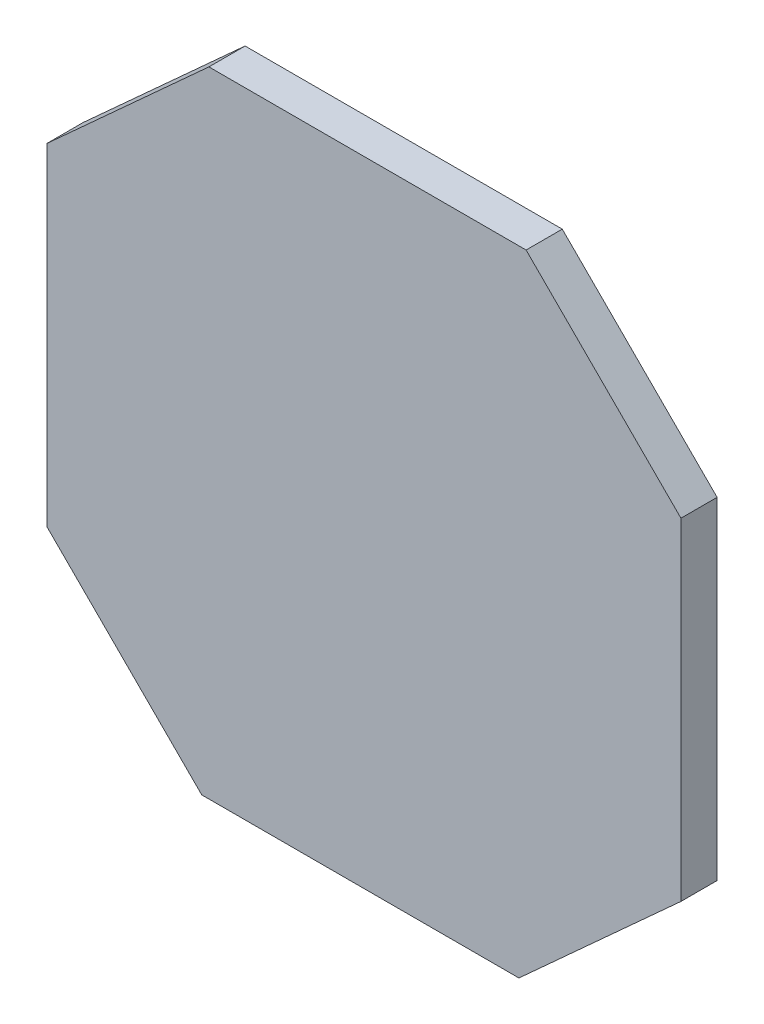
from build123d import *

# Parameters (mm, degrees)
BOSS_EXTRUDE1_DEPTH = 5.12


with BuildPart() as part:
    # Sketch1 → Boss-Extrude1 (new body)
    with BuildSketch(Plane.XY):
        Polygon((20.678672923, 89.649954591), (-2.25890757, 68.796480034), (-2.25890757, 21.810264808), (19.661402647, -0.110045409), (64.563511937, -0.110045409), (87.50109243, 20.743429149), (87.50109243, 67.729644374), (65.580782213, 89.649954591), align=None)
    extrude(amount=BOSS_EXTRUDE1_DEPTH)


solid = part.part
